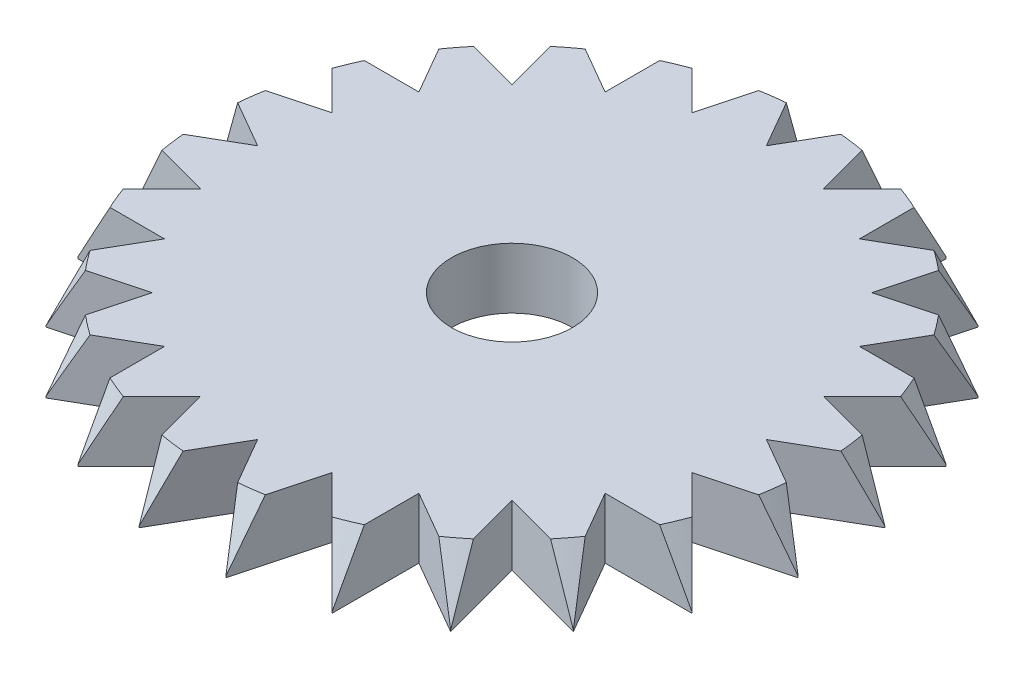
from build123d import *

# Parameters (mm, degrees)
SKETCH1_R          = 25
SKETCH2_R          = 27.5
CUT_EXTRUDE7_DEPTH = 9
CIRPATTERN10_COUNT = 24
SKETCH13_R         = 5
CUT_EXTRUDE8_DEPTH = 9
CUT_EXTRUDE1_DEPTH = 2


with BuildPart() as part:
    # Sketch1 → Loft1 section 0
    with BuildSketch(Plane(origin=(0, 0, 0), x_dir=(1, 0, 0), z_dir=(0, 1, 0))):
        Circle(SKETCH1_R)
    # Sketch2 → Loft1 section 1
    with BuildSketch(Plane(origin=(0, -5, 0), x_dir=(1, 0, 0), z_dir=(0, 1, 0))):
        Circle(SKETCH2_R)
    loft()

    # Sketch12 → Cut-Extrude7 (cut)
    with BuildSketch(Plane(origin=(0, 0, 0), x_dir=(1, 0, 0), z_dir=(0, 1, 0))):
        with BuildLine():
            Line((0, -21), (-3.706867321, -27.420482537))
            ThreePointArc((-3.706867321, -27.420482537), (0, -27.669906539), (3.706867321, -27.420482537))
            Line((3.706867321, -27.420482537), (0, -21))
        make_face()
    cut_extrude7 = extrude(amount=-CUT_EXTRUDE7_DEPTH, mode=Mode.SUBTRACT)

    # CirPattern10: Cut-Extrude7 ×24 about axis
    cirpattern10_axis = Axis((0, 0, 0), (0, 1, 0))
    for i in range(1, CIRPATTERN10_COUNT):
        add(cut_extrude7.rotate(cirpattern10_axis, i * 360 / CIRPATTERN10_COUNT), mode=Mode.SUBTRACT)

    # Sketch13 → Cut-Extrude8 (cut)
    with BuildSketch(Plane(origin=(0, 0, 0), x_dir=(1, 0, 0), z_dir=(0, 1, 0))):
        Circle(SKETCH13_R)
    extrude(amount=-CUT_EXTRUDE8_DEPTH, mode=Mode.SUBTRACT)

    # Sketch4 → Cut-Extrude1 (cut)
    with BuildSketch(Plane(origin=(2, 0, 0), x_dir=(0, 0, -1), z_dir=(1, 0, 0))):
        Polygon((-45.141797346, -2.50005), (-25, 0), (-45.141797346, 0), align=None)
    extrude(amount=-CUT_EXTRUDE1_DEPTH, mode=Mode.SUBTRACT)


solid = part.part
